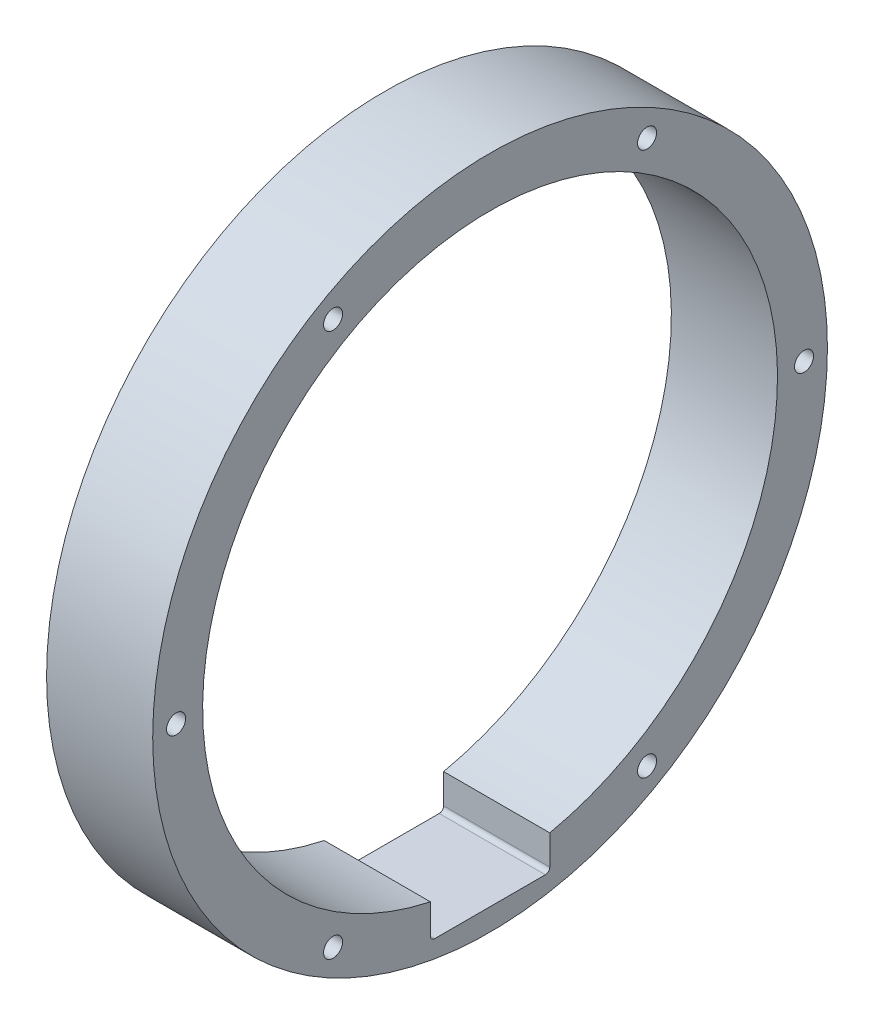
from build123d import *

# Parameters (mm, degrees)
SKETCH1_R           = 76.29
SKETCH1_R_2         = 65
BOSS_EXTRUDE1_DEPTH = 24
CUT_EXTRUDE1_REACH  = 112.527
CUT_EXTRUDE2_REACH  = 112.527
SKETCH3_R           = 2.15


with BuildPart() as part:
    # Sketch1 → Boss-Extrude1 (new body)
    with BuildSketch(Plane(origin=(0, 0, 0), x_dir=(0, 0, -1), z_dir=(1, 0, 0))):
        Circle(SKETCH1_R)
        Circle(SKETCH1_R_2, mode=Mode.SUBTRACT)
    extrude(amount=BOSS_EXTRUDE1_DEPTH)

    # Sketch2 → Cut-Extrude1 (cut, up to next)
    with BuildSketch(Plane(origin=(24, 0, 0), x_dir=(0, 0, -1), z_dir=(1, 0, 0)), mode=Mode.PRIVATE) as cut_extrude1_sk1:
        with BuildLine():
            Line((-13.5, -51.893967527), (13.5, -51.893967527))
            Line((13.5, -51.893967527), (13.5, -70.29))
            ThreePointArc((13.5, -70.29), (13.207106781, -70.997106781), (12.5, -71.29))
            Line((12.5, -71.29), (-12.5, -71.29))
            ThreePointArc((-12.5, -71.29), (-13.207106781, -70.997106781), (-13.5, -70.29))
            Line((-13.5, -70.29), (-13.5, -51.893967527))
        make_face()
    cut_extrude1_tool1 = extrude(cut_extrude1_sk1.sketch, amount=-CUT_EXTRUDE1_REACH, mode=Mode.PRIVATE) & part.part
    add(cut_extrude1_tool1.solids().sort_by_distance((24, -61.584212, 0))[0], mode=Mode.SUBTRACT)

    # Sketch3 → Cut-Extrude2 (cut, up to next)
    with BuildSketch(Plane(origin=(24, 0, 0), x_dir=(0, 0, -1), z_dir=(1, 0, 0)), mode=Mode.PRIVATE) as cut_extrude2_sk1:
        with Locations((-71, 0)):
            Circle(SKETCH3_R)
    cut_extrude2_tool1 = extrude(cut_extrude2_sk1.sketch, amount=-CUT_EXTRUDE2_REACH, mode=Mode.PRIVATE) & part.part
    # Sketch3 → Cut-Extrude2 (cut, up to next)
    with BuildSketch(Plane(origin=(24, 0, 0), x_dir=(0, 0, -1), z_dir=(1, 0, 0)), mode=Mode.PRIVATE) as cut_extrude2_sk2:
        with Locations((-35.5, 61.487803669)):
            Circle(SKETCH3_R)
    cut_extrude2_tool2 = extrude(cut_extrude2_sk2.sketch, amount=-CUT_EXTRUDE2_REACH, mode=Mode.PRIVATE) & part.part
    # Sketch3 → Cut-Extrude2 (cut, up to next)
    with BuildSketch(Plane(origin=(24, 0, 0), x_dir=(0, 0, -1), z_dir=(1, 0, 0)), mode=Mode.PRIVATE) as cut_extrude2_sk3:
        with Locations((35.5, 61.487803669)):
            Circle(SKETCH3_R)
    cut_extrude2_tool3 = extrude(cut_extrude2_sk3.sketch, amount=-CUT_EXTRUDE2_REACH, mode=Mode.PRIVATE) & part.part
    # Sketch3 → Cut-Extrude2 (cut, up to next)
    with BuildSketch(Plane(origin=(24, 0, 0), x_dir=(0, 0, -1), z_dir=(1, 0, 0)), mode=Mode.PRIVATE) as cut_extrude2_sk4:
        with Locations((71, 0)):
            Circle(SKETCH3_R)
    cut_extrude2_tool4 = extrude(cut_extrude2_sk4.sketch, amount=-CUT_EXTRUDE2_REACH, mode=Mode.PRIVATE) & part.part
    # Sketch3 → Cut-Extrude2 (cut, up to next)
    with BuildSketch(Plane(origin=(24, 0, 0), x_dir=(0, 0, -1), z_dir=(1, 0, 0)), mode=Mode.PRIVATE) as cut_extrude2_sk5:
        with Locations((35.5, -61.487803669)):
            Circle(SKETCH3_R)
    cut_extrude2_tool5 = extrude(cut_extrude2_sk5.sketch, amount=-CUT_EXTRUDE2_REACH, mode=Mode.PRIVATE) & part.part
    # Sketch3 → Cut-Extrude2 (cut, up to next)
    with BuildSketch(Plane(origin=(24, 0, 0), x_dir=(0, 0, -1), z_dir=(1, 0, 0)), mode=Mode.PRIVATE) as cut_extrude2_sk6:
        with Locations((-35.5, -61.487803669)):
            Circle(SKETCH3_R)
    cut_extrude2_tool6 = extrude(cut_extrude2_sk6.sketch, amount=-CUT_EXTRUDE2_REACH, mode=Mode.PRIVATE) & part.part
    add(cut_extrude2_tool1.solids().sort_by_distance((24, 0, 71))[0], mode=Mode.SUBTRACT)
    add(cut_extrude2_tool2.solids().sort_by_distance((24, 61.487804, 35.5))[0], mode=Mode.SUBTRACT)
    add(cut_extrude2_tool3.solids().sort_by_distance((24, 61.487804, -35.5))[0], mode=Mode.SUBTRACT)
    add(cut_extrude2_tool4.solids().sort_by_distance((24, 0, -71))[0], mode=Mode.SUBTRACT)
    add(cut_extrude2_tool5.solids().sort_by_distance((24, -61.487804, -35.5))[0], mode=Mode.SUBTRACT)
    add(cut_extrude2_tool6.solids().sort_by_distance((24, -61.487804, 35.5))[0], mode=Mode.SUBTRACT)


solid = part.part
